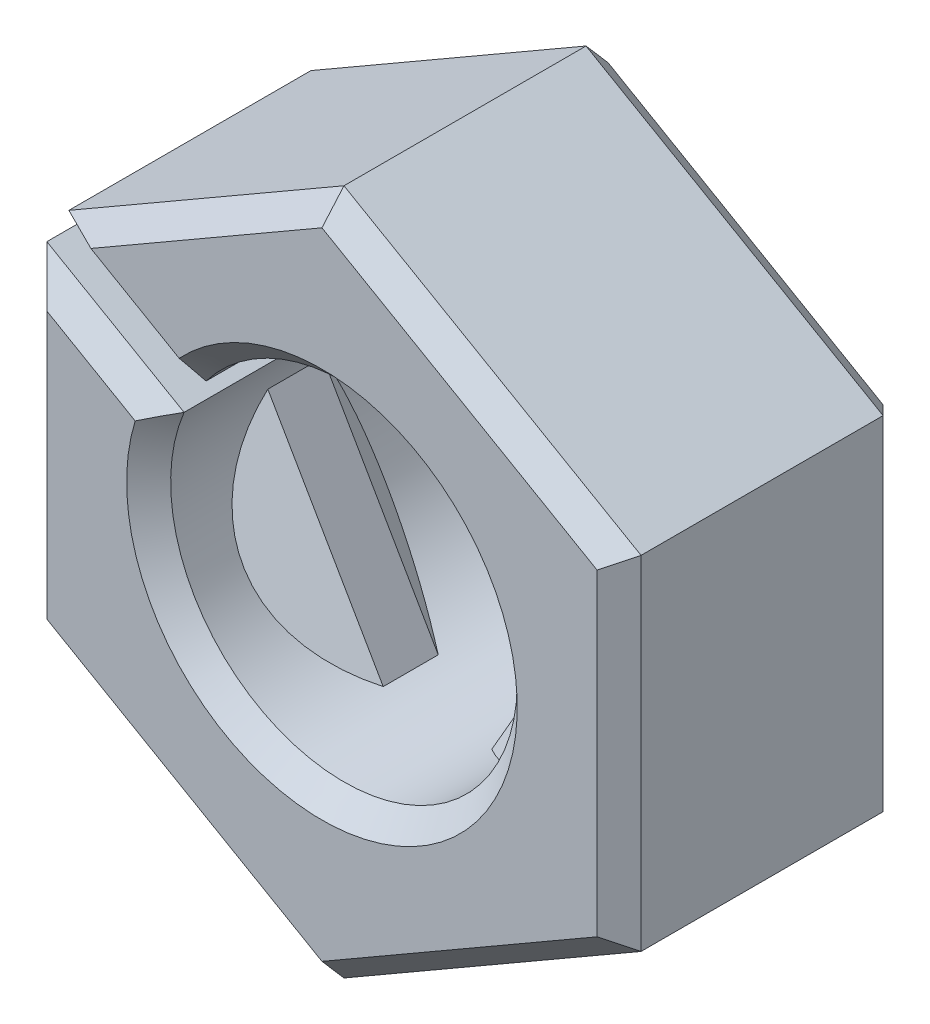
from build123d import *

# Parameters (mm, degrees)
SKETCH1_R              = 1.575
BOSS_EXTRUDE1_DEPTH    = 1.3
CLIP_REACH             = 6.324
CLIP_DIRECTION_2_REACH = 6.324
CLIPS_X3_COUNT         = 3
SPLIT_2_DEPTH          = 5.324349662
SPLIT_2_DEPTH_BACK     = 5.324349662
DEBURS_SIZE            = 0.2


with BuildPart() as part:
    # Sketch1 → Boss-Extrude1 (new, symmetric)
    with BuildSketch(Plane.XY):
        Polygon((2.7, -1.558845727), (2.7, 1.558845727), (0, 3.117691454), (-2.7, 1.558845727), (-2.7, -1.558845727), (0, -3.117691454), align=None)
        Circle(SKETCH1_R, mode=Mode.SUBTRACT)
    extrude(amount=BOSS_EXTRUDE1_DEPTH, both=True)

    # Sketch3 → Clip (add, up to next)
    with BuildSketch(Plane(origin=(0, 0, 0), x_dir=(0, 0, -1), z_dir=(1, 0, 0)), mode=Mode.PRIVATE) as clip_sk1:
        Polygon((-0.65, 1.575), (0.65, 1.575), (0.25, 1.175), (-0.25, 1.175), align=None)
    clip_tool1 = extrude(clip_sk1.sketch, amount=CLIP_REACH, mode=Mode.PRIVATE) - part.part
    clip = clip_tool1.solids().sort_by_distance((0, 1.40463, 0))[0]
    add(clip)

    # Sketch3 → Clip direction 2 (add, up to next)
    with BuildSketch(Plane(origin=(0, 0, 0), x_dir=(0, 0, -1), z_dir=(1, 0, 0)), mode=Mode.PRIVATE) as clip_direction_2_sk1:
        Polygon((-0.65, 1.575), (0.65, 1.575), (0.25, 1.175), (-0.25, 1.175), align=None)
    clip_direction_2_tool1 = extrude(clip_direction_2_sk1.sketch, amount=-CLIP_DIRECTION_2_REACH, mode=Mode.PRIVATE) - part.part
    clip_direction_2 = clip_direction_2_tool1.solids().sort_by_distance((0, 1.40463, 0))[0]
    add(clip_direction_2)

    # Clips x3: Clip, Clip direction 2 ×3 about axis
    clips_x3_axis = Axis((0, 0, 1.3), (0, 0, 1))
    add([clip.rotate(clips_x3_axis, i * 360 / CLIPS_X3_COUNT) for i in range(1, CLIPS_X3_COUNT)])
    add([clip_direction_2.rotate(clips_x3_axis, i * 360 / CLIPS_X3_COUNT) for i in range(1, CLIPS_X3_COUNT)])

    # Sketch4 → Split 2 (cut, two sides: drawn at the far end of the back side and taken through both)
    with BuildSketch(Plane.XY.offset(-SPLIT_2_DEPTH_BACK)):
        Polygon((-2.8, 1.385640646), (-0.1, -0.173205081), (0.1, 0.173205081), (-2.6, 1.732050808), align=None)
    extrude(amount=SPLIT_2_DEPTH + SPLIT_2_DEPTH_BACK, mode=Mode.SUBTRACT)

    # Deburs
    deburs_edges = [part.edges().sort_by_distance(p)[0] for p in [
        (-0.310025509, -1.544185605, -1.3),
        (2.7, 0, -1.3),
        (1.35, 2.33826859, -1.3),
        (-1.25, 2.396003617, -1.3),
        (-2.7, -0.115470054, -1.3),
        (-1.35, -2.33826859, -1.3),
        (1.35, -2.33826859, -1.3),
        (-0.310025509, -1.544185605, 1.3),
        (-1.35, -2.33826859, 1.3),
        (-2.7, -0.115470054, 1.3),
        (-1.25, 2.396003617, 1.3),
        (1.35, 2.33826859, 1.3),
        (2.7, 0, 1.3),
        (1.35, -2.33826859, 1.3),
        (-1.876474085, 1.314322926, -1.3),
        (-2.076474085, 0.967912764, -1.3),
        (-1.876474085, 1.314322926, 1.3),
        (-2.076474085, 0.967912764, 1.3),
    ]]
    chamfer(deburs_edges, length=DEBURS_SIZE)


solid = part.part
